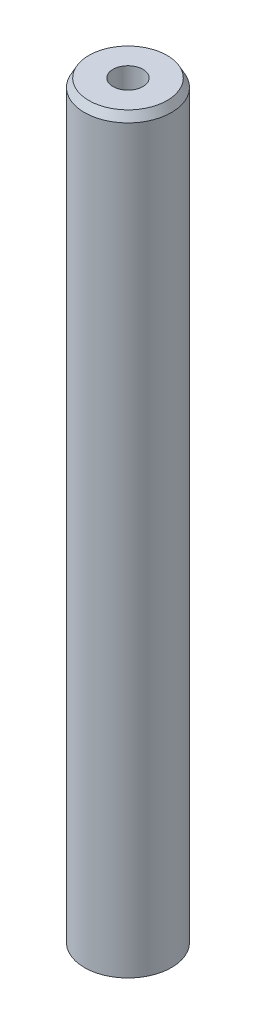
from build123d import *
from OCP.BRepFilletAPI import BRepFilletAPI_MakeChamfer

# Parameters (mm, degrees)
SKETCH1_R           = 15
BOSS_EXTRUDE1_DEPTH = 259.522813605
SKETCH2_R           = 5.165528254
CUT_EXTRUDE1_DEPTH  = 261.388346094
CHAMFER1_SIZE       = 2.821732567
CHAMFER1_SIZE2      = 1.517882998


with BuildPart() as part:
    # Sketch1 → Boss-Extrude1 (new body)
    with BuildSketch(Plane(origin=(0, 0, 0), x_dir=(1, 0, 0), z_dir=(0, 1, 0))):
        Circle(SKETCH1_R)
    extrude(amount=BOSS_EXTRUDE1_DEPTH)

    # Sketch2 → Cut-Extrude1 (cut, through all)
    with BuildSketch(Plane(origin=(0, 0, 0), x_dir=(1, 0, 0), z_dir=(0, 1, 0))):
        Circle(SKETCH2_R)
    extrude(amount=CUT_EXTRUDE1_DEPTH, mode=Mode.SUBTRACT)

    # Chamfer1: one chamfer whose edges measure the first distance from different faces: ONE call of the kernel's chamfer builder (chamfer() names one face for all edges)
    chamfer1_edges_1 = [part.edges().sort_by_distance(p)[0] for p in [
        (-15, 259.522813605, 0),
    ]]
    chamfer1_side_1 = [part.faces().sort_by_distance(p)[0] for p in [
        (-15, 129.761406803, 0),
    ]]
    chamfer1_edges_2 = [part.edges().sort_by_distance(p)[0] for p in [
        (-15, 0, 0),
    ]]
    chamfer1_side_2 = [part.faces().sort_by_distance(p)[0] for p in [
        (-14.575735931, 0, 0),
    ]]
    chamfer1 = BRepFilletAPI_MakeChamfer(part.part.solid().wrapped)
    for e in chamfer1_edges_1:
        chamfer1.Add(CHAMFER1_SIZE, CHAMFER1_SIZE2, e.wrapped, chamfer1_side_1[0].wrapped)  # the first distance lies on this face
    for e in chamfer1_edges_2:
        chamfer1.Add(CHAMFER1_SIZE, CHAMFER1_SIZE2, e.wrapped, chamfer1_side_2[0].wrapped)  # the first distance lies on this face
    add(Compound.cast(chamfer1.Shape()), mode=Mode.REPLACE)


solid = part.part
